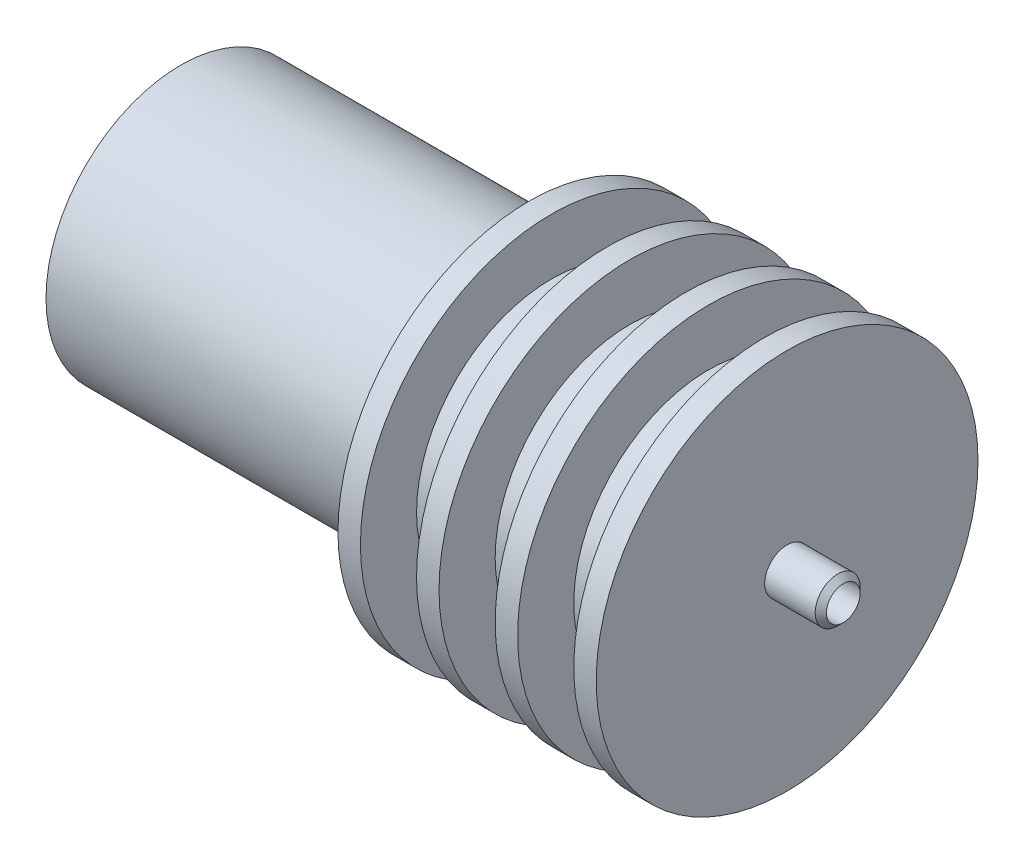
from build123d import *

# Parameters (mm, degrees)
SKETCH_1_W          = 46
SKETCH_1_H          = 2
SKETCH_8_R          = 12
SKETCH_8_R_2        = 10
EXTRUDE_3_DEPTH     = 3
SKETCH_9_R          = 12
EXTRUDE_5_DEPTH     = 5
SKETCH_11_R         = 10
CUT_EXTRUDE_7_DEPTH = 52
SKETCH_12_R         = 1.5
CUT_EXTRUDE_8_DEPTH = 57.603886792
EXTRUDE_START       = -2
SKETCH_14_R         = 17
SKETCH_14_R_2       = 12
EXTRUDE_6_DEPTH     = 2
EXTRUDE_START_2     = -9
SKETCH_15_R         = 17
SKETCH_15_R_2       = 12
EXTRUDE_7_DEPTH     = 2
EXTRUDE_START_3     = 7
SKETCH_20_R         = 17
SKETCH_20_R_2       = 12
EXTRUDE_11_DEPTH    = 2
SKETCH_21_R         = 17
SKETCH_21_R_2       = 10
EXTRUDE_12_DEPTH    = 2
SKETCH_22_R         = 2
SKETCH_22_R_2       = 1.5
EXTRUDE_13_DEPTH    = 5
CHAMFER_1_SIZE      = 0.5


with BuildPart() as part:
    # 草图1 → 旋转1 (revolve)
    with BuildSketch(Plane.XY, mode=Mode.PRIVATE) as revolve_1_sk:
        with Locations((-3, 11)):
            Rectangle(SKETCH_1_W, SKETCH_1_H)
    revolve(revolve_1_sk.sketch.rotate(Axis((-26, 0, 0), (1, 0, 0)), 90), axis=Axis((-26, 0, 0), (1, 0, 0)))

    # 草图8 → 凸台-拉伸3 (add)
    with BuildSketch(Plane(origin=(20, 0, 0), x_dir=(0, 0, -1), z_dir=(1, 0, 0))):
        with Locations(Location((0, 0, 0), (0, 0, 180))):
            Circle(SKETCH_8_R)
        with Locations(Location((0, 0, 0), (0, 0, 180))):
            Circle(SKETCH_8_R_2, mode=Mode.SUBTRACT)
    extrude(amount=EXTRUDE_3_DEPTH)

    # 草图15 → 凸台-拉伸7 (add)
    with BuildSketch(Plane(origin=(28, 0, 0), x_dir=(0, 0, -1), z_dir=(1, 0, 0)).offset(EXTRUDE_START_2)):
        Circle(SKETCH_15_R)
        Circle(SKETCH_15_R_2, mode=Mode.SUBTRACT)
    extrude(amount=EXTRUDE_7_DEPTH)

    # 草图20 → 凸台-拉伸11 (add)
    with BuildSketch(Plane.ZY.offset(-19).offset(EXTRUDE_START_3)):
        with Locations(Location((0, 0, 0), (0, 0, 180))):
            Circle(SKETCH_20_R)
        with Locations(Location((0, 0, 0), (0, 0, 180))):
            Circle(SKETCH_20_R_2, mode=Mode.SUBTRACT)
    extrude(amount=-EXTRUDE_11_DEPTH)

    # 草图21 → 凸台-拉伸12 (add)
    with BuildSketch(Plane.ZY.offset(-12).offset(EXTRUDE_START_3)):
        with Locations(Location((0, 0, 0), (0, 0, 180))):
            Circle(SKETCH_21_R)
        Circle(SKETCH_21_R_2, mode=Mode.SUBTRACT)
    extrude(amount=-EXTRUDE_12_DEPTH)


with BuildPart() as body_2:
    # 草图9 → 凸台-拉伸5 (new body)
    with BuildSketch(Plane(origin=(23, 0, 0), x_dir=(0, 0, -1), z_dir=(1, 0, 0))):
        Circle(SKETCH_9_R)
    extrude(amount=EXTRUDE_5_DEPTH)

    # 草图11 → 切除-拉伸7 (cut)
    with BuildSketch(Plane.ZY.offset(26)):
        Circle(SKETCH_11_R)
    extrude(amount=-CUT_EXTRUDE_7_DEPTH, mode=Mode.SUBTRACT)

    # 草图12 → 切除-拉伸8 (cut, through all)
    with BuildSketch(Plane(origin=(28, 0, 0), x_dir=(0, 0, -1), z_dir=(1, 0, 0))):
        Circle(SKETCH_12_R)
    extrude(amount=-CUT_EXTRUDE_8_DEPTH, mode=Mode.SUBTRACT)

    # 草图14 → 凸台-拉伸6 (add)
    with BuildSketch(Plane(origin=(28, 0, 0), x_dir=(0, 0, -1), z_dir=(1, 0, 0)).offset(EXTRUDE_START)):
        Circle(SKETCH_14_R)
        Circle(SKETCH_14_R_2, mode=Mode.SUBTRACT)
    extrude(amount=EXTRUDE_6_DEPTH)

    # 草图22 → 凸台-拉伸13 (add)
    with BuildSketch(Plane(origin=(28, 0, 0), x_dir=(0, 0, -1), z_dir=(1, 0, 0))):
        Circle(SKETCH_22_R)
        Circle(SKETCH_22_R_2, mode=Mode.SUBTRACT)
    extrude(amount=EXTRUDE_13_DEPTH)

    # 倒角1
    chamfer_1_edges = [body_2.edges().sort_by_distance(p)[0] for p in [
        (33, 0, 2),
    ]]
    chamfer(chamfer_1_edges, length=CHAMFER_1_SIZE - 0.0001)  # a hair under: the kernel refuses the full size


solid = Compound([part.part, body_2.part])
